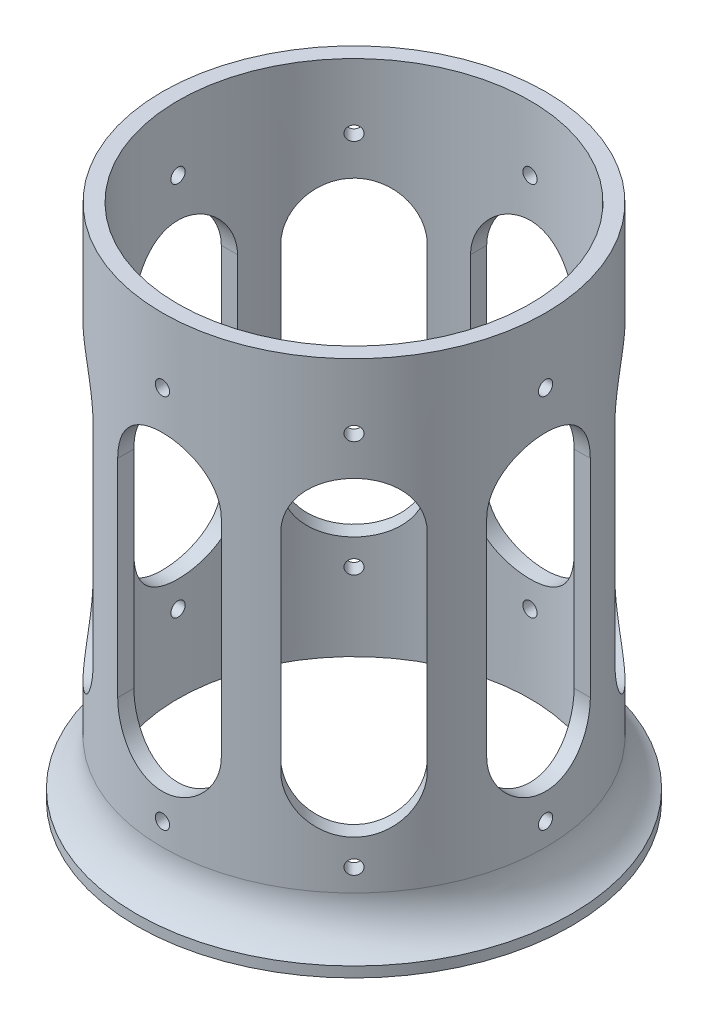
from build123d import *

# Parameters (mm, degrees)
SKETCH2_R                       = 37
SKETCH2_R_2                     = 34
MAIN_EXTRUDE_DEPTH              = 100
SKETCH3_R                       = 1.375
SCREWHOLE_DEPTH                 = 100
WEIGHT_REDUCTION_DEPTH          = 100
SCREWHOLE_PATTERN_COUNT         = 8
SKETCH5_R                       = 42
SKETCH5_R_2                     = 34
PLATE_FOR_BETTER_ADHESION_DEPTH = 2
FILLET1_R                       = 10


with BuildPart() as part:
    # Sketch2 → Main extrude (new body)
    with BuildSketch(Plane(origin=(0, 0, 0), x_dir=(1, 0, 0), z_dir=(0, 1, 0))):
        with Locations(Location((0, 0, 0), (0, 0, 270))):
            Circle(SKETCH2_R)
        with Locations(Location((0, 0, 0), (0, 0, 270))):
            Circle(SKETCH2_R_2, mode=Mode.SUBTRACT)
    extrude(amount=MAIN_EXTRUDE_DEPTH)

    # Sketch3 → Screwhole (cut)
    with BuildSketch(Plane.XY):
        with Locations(Location((0, 15, 0), (0, 0, 180))):
            Circle(SKETCH3_R)
        with Locations(Location((0, 87.5, 0), (0, 0, 180))):
            Circle(SKETCH3_R)
    screwhole = extrude(amount=SCREWHOLE_DEPTH, mode=Mode.SUBTRACT)

    # Sketch4 → Weight reduction (cut)
    with BuildSketch(Plane.XY):
        with BuildLine():
            Line((10, 70), (10, 30))
            ThreePointArc((10, 30), (0, 20), (-10, 30))
            Line((-10, 30), (-10, 70))
            ThreePointArc((-10, 70), (0, 80), (10, 70))
        make_face()
    weight_reduction = extrude(amount=WEIGHT_REDUCTION_DEPTH, mode=Mode.SUBTRACT)

    # Screwhole pattern: Screwhole, Weight reduction ×8 about axis
    screwhole_pattern_axis = Axis((0, 0, 0), (0, 1, 0))
    add([screwhole.rotate(screwhole_pattern_axis, i * 360 / SCREWHOLE_PATTERN_COUNT) for i in range(1, SCREWHOLE_PATTERN_COUNT)], mode=Mode.SUBTRACT)
    add([weight_reduction.rotate(screwhole_pattern_axis, i * 360 / SCREWHOLE_PATTERN_COUNT) for i in range(1, SCREWHOLE_PATTERN_COUNT)], mode=Mode.SUBTRACT)

    # Sketch5 → Plate for better adhesion (add)
    with BuildSketch(Plane.XZ):
        with Locations(Location((0, 0, 0), (0, 0, 270))):
            Circle(SKETCH5_R)
        with Locations(Location((0, 0, 0), (0, 0, 90))):
            Circle(SKETCH5_R_2, mode=Mode.SUBTRACT)
    extrude(amount=-PLATE_FOR_BETTER_ADHESION_DEPTH)

    # Fillet1
    # the kernel refuses this fillet: 10 mm, written as the material it adds along each edge
    with BuildSketch(Plane(origin=(0, 2, 0), x_dir=(0, 0, 1), z_dir=(1, 0, 0))) as fillet1_piece_1:
        with BuildLine():
            CenterArc((47, -8.660254038), FILLET1_R, 120, 60)
            Line((37, -8.660254038), (36.8, -8.660254038))
            Line((36.8, -8.660254038), (36.8, 0))
            Line((36.8, 0), (37, 0.2))
            ThreePointArc((37, 0.2), (39.5, 0.2), (41.9, 0.173205081))
            Line((41.9, 0.173205081), (42, 0))
        make_face()
    revolve(axis=Axis((0, 2, 0), (0, -1, 0)))


solid = part.part
